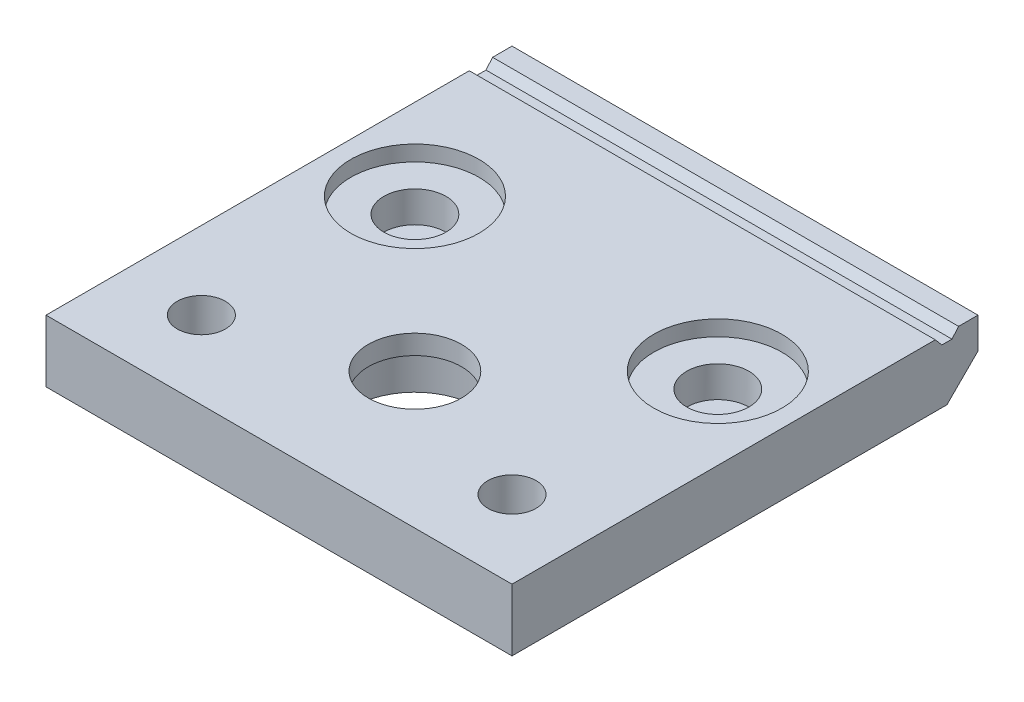
from build123d import *

# Parameters (mm, degrees)
SKETCH_1_W                = 60
SKETCH_1_H                = 60
SKETCH_1_R                = 2.75
SKETCH_1_R_2              = 6
EXTRUDE_1_DEPTH           = 8
SKETCH_3_R                = 4
CUT_EXTRUDE_2_DEPTH       = 6
SKETCH_1_3_R              = 8
SKETCH_1_3_R_2            = 6
CUT_EXTRUDE_4_DEPTH       = 5.5
SKETCH_6_R                = 8.25
CUT_EXTRUDE_5_DEPTH       = 2
CHAMFER_1_SIZE            = 4
HOLE_WIZARD_1_D           = 6.2
HOLE_WIZARD_1_CSINK_D     = 12.5
HOLE_WIZARD_1_CSINK_ANGLE = 90
CUT_EXTRUDE_6_DEPTH       = 68.557383016


with BuildPart() as part:
    # 草图1 → 凸台-拉伸1 (new body)
    with BuildSketch(Plane(origin=(0, 0, 0), x_dir=(1, 0, 0), z_dir=(0, 1, 0))):
        Rectangle(SKETCH_1_W, SKETCH_1_H)
        with Locations((-20, -20)):
            Circle(SKETCH_1_R, mode=Mode.SUBTRACT)
        with Locations((20, -20)):
            Circle(SKETCH_1_R, mode=Mode.SUBTRACT)
        with Locations((0, -12.5)):
            Circle(SKETCH_1_R_2, mode=Mode.SUBTRACT)
    extrude(amount=EXTRUDE_1_DEPTH)

    # 草图3 → 切除-拉伸2 (cut)
    with BuildSketch(Plane(origin=(0, 8, 0), x_dir=(1, 0, 0), z_dir=(0, 1, 0))):
        with Locations((-19.5, 7)):
            Circle(SKETCH_3_R)
        with Locations((19.5, 7)):
            Circle(SKETCH_3_R)
    extrude(amount=-CUT_EXTRUDE_2_DEPTH, mode=Mode.SUBTRACT)

    # 草图1<3> → 切除-拉伸4 (cut)
    with BuildSketch(Plane(origin=(0, 0, 0), x_dir=(1, 0, 0), z_dir=(0, 1, 0))):
        with Locations((0, -12.5)):
            Circle(SKETCH_1_3_R)
        with Locations((0, -12.5)):
            Circle(SKETCH_1_3_R_2, mode=Mode.SUBTRACT)
    extrude(amount=CUT_EXTRUDE_4_DEPTH, mode=Mode.SUBTRACT)

    # 草图6 → 切除-拉伸5 (cut)
    with BuildSketch(Plane(origin=(0, 8, 0), x_dir=(1, 0, 0), z_dir=(0, 1, 0))):
        with Locations((-19.5, 7)):
            Circle(SKETCH_6_R)
        with Locations((19.5, 7)):
            Circle(SKETCH_6_R)
    extrude(amount=-CUT_EXTRUDE_5_DEPTH, mode=Mode.SUBTRACT)

    # 倒角1
    chamfer_1_edges = [part.edges().sort_by_distance(p)[0] for p in [
        (0, 0, -30),
    ]]
    chamfer(chamfer_1_edges, length=CHAMFER_1_SIZE)

    # 打孔尺寸(%根据十字)槽半沉头木螺钉的类型1 (through all)
    with Locations(Plane(origin=(-20, 0, 20), x_dir=(0, 0, -1), z_dir=(0, -1, 0))):
        with Locations((0, 0), (0, 40)):
            CounterSinkHole(HOLE_WIZARD_1_D / 2, HOLE_WIZARD_1_CSINK_D / 2, counter_sink_angle=HOLE_WIZARD_1_CSINK_ANGLE)

    # 草图8 → 切除-拉伸6 (cut, through all)
    with BuildSketch(Plane(origin=(30, 0, 0), x_dir=(0, 0, -1), z_dir=(1, 0, 0))):
        Polygon((24.5, 8), (27.5, 8), (26.65, 7), (25.35, 7), align=None)
    extrude(amount=-CUT_EXTRUDE_6_DEPTH, mode=Mode.SUBTRACT)


solid = part.part
